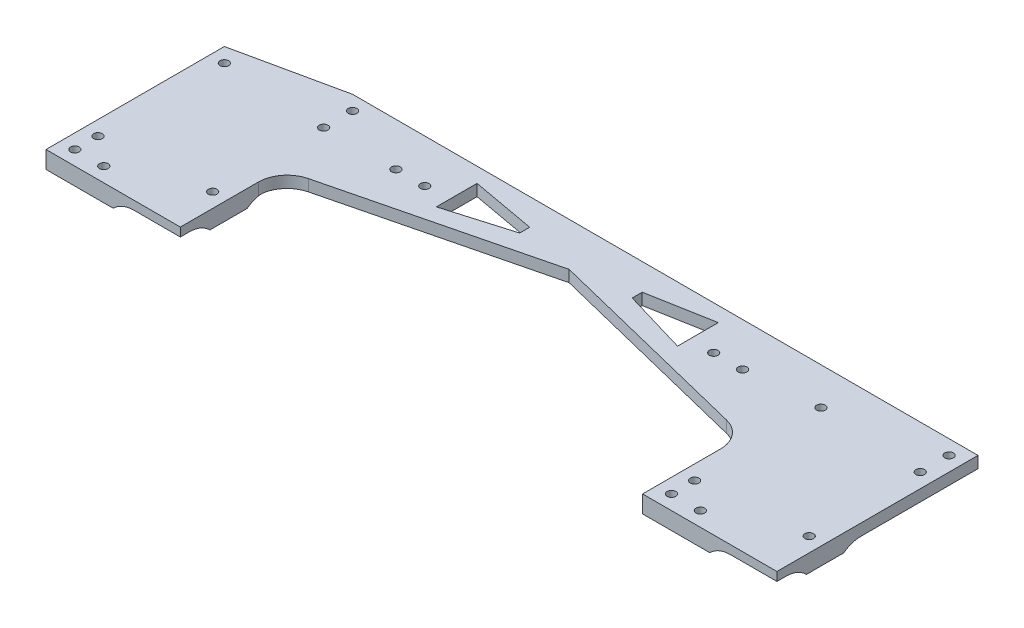
from build123d import *

# Parameters (mm, degrees)
SKETCH1_R           = 1.5
BOSS_EXTRUDE1_DEPTH = 3
SKETCH2_W           = 26.5
SKETCH2_H           = 13.12704922
BOSS_EXTRUDE2_DEPTH = 3
SKETCH3_R           = 1.5
CUT_EXTRUDE1_DEPTH  = 10
SKETCH4_R           = 1.5
CUT_EXTRUDE2_DEPTH  = 10
BOSS_EXTRUDE4_START = -4
SKETCH6_R           = 1.5
SKETCH6_W           = 26.5
SKETCH6_H           = 25.74798773
BOSS_EXTRUDE4_DEPTH = 4
SKETCH9_R           = 1.5
CUT_EXTRUDE3_DEPTH  = 6
CUT_EXTRUDE4_DEPTH  = 14
SKETCH11_R          = 1.5
CUT_EXTRUDE5_DEPTH  = 14
SKETCH12_W          = 9.439157555
SKETCH12_H          = 13.291874924
CUT_EXTRUDE6_DEPTH  = 10
BOSS_EXTRUDE5_START = -6
SKETCH14_R          = 1.5
SKETCH14_R_2        = 1.624180029
SKETCH14_W          = 10
SKETCH14_H          = 12.873993865
SKETCH14_R_3        = 1.585240738
BOSS_EXTRUDE5_DEPTH = 6
SKETCH15_W          = 23.25
SKETCH15_H          = 10.234024539
CUT_EXTRUDE7_DEPTH  = 3
FILLET2_R           = 10
FILLET4_R           = 10
SKETCH16_W          = 26.5
SKETCH16_H          = 25.74798773
SKETCH16_H_2        = 10.370938511
SKETCH16_W_2        = 9.439157555
SKETCH16_H_3        = 13.291874924
BOSS_EXTRUDE6_DEPTH = 4
FILLET5_R           = 10


with BuildPart() as part:
    # Sketch1 → Boss-Extrude1 (new body)
    with BuildSketch(Plane(origin=(0, 0, 0), x_dir=(1, 0, 0), z_dir=(0, 1, 0))):
        Polygon((-5, -5), (41.5, -5), (41.5, 64.6), (31.5, 64.6), (-5, 56.73), align=None)
        Polygon((31.5, 54.48), (31.5, 5.234024539), (5, 5.234024539), (5, 56.73), align=None, mode=Mode.SUBTRACT)
        with Locations(Location((0, 0, 0), (0, 0, 270))):
            Circle(SKETCH1_R, mode=Mode.SUBTRACT)
        with Locations(Location((0, 51.73, 0), (0, 0, 270))):
            Circle(SKETCH1_R, mode=Mode.SUBTRACT)
        with Locations(Location((36.5, 59.6, 0), (0, 0, 270))):
            Circle(SKETCH1_R, mode=Mode.SUBTRACT)
        with Locations(Location((36.5, 11.18, 0), (0, 0, 270))):
            Circle(SKETCH1_R, mode=Mode.SUBTRACT)
        with Locations(Location((36.5, 49.6, 0), (0, 0, 270))):
            Circle(SKETCH1_R, mode=Mode.SUBTRACT)
    extrude(amount=BOSS_EXTRUDE1_DEPTH)

    # Sketch2 → Boss-Extrude2 (add)
    with BuildSketch(Plane(origin=(0, 3, 0), x_dir=(1, 0, 0), z_dir=(0, 1, 0))):
        with Locations((18.25, 37.545536879)):
            Rectangle(SKETCH2_W, SKETCH2_H)
        Polygon((5, 56.73), (5, 49.867078553), (31.5, 54.48), align=None)
    extrude(amount=-BOSS_EXTRUDE2_DEPTH)

    # Sketch3 → Cut-Extrude1 (cut)
    with BuildSketch(Plane(origin=(0, 3, 0), x_dir=(1, 0, 0), z_dir=(0, 1, 0))):
        with Locations(Location((10, 0, 0), (0, 0, 270))):
            Circle(SKETCH3_R)
    extrude(amount=-CUT_EXTRUDE1_DEPTH, mode=Mode.SUBTRACT)

    # Sketch4 → Cut-Extrude2 (cut)
    with BuildSketch(Plane(origin=(0, 3, 0), x_dir=(1, 0, 0), z_dir=(0, 1, 0))):
        with Locations(Location((0, 8, 0), (0, 0, 270))):
            Circle(SKETCH4_R)
    extrude(amount=-CUT_EXTRUDE2_DEPTH, mode=Mode.SUBTRACT)

    # Sketch6 → Boss-Extrude4 (add)
    # profile 1 of 3: a face of its own
    with BuildSketch(Plane(origin=(0, 3, 0), x_dir=(1, 0, 0), z_dir=(0, 1, 0)).offset(BOSS_EXTRUDE4_START)):
        Polygon((238, 64.6), (41.5, 64.6), (41.5, 29.8), (121.5, 49.6), (201.5, 29.8), (201.5, 56.73), align=None)
    # profile 2 of 3: a face of its own
    with BuildSketch(Plane(origin=(0, 3, 0), x_dir=(1, 0, 0), z_dir=(0, 1, 0)).offset(BOSS_EXTRUDE4_START)):
        Polygon((31.5, 64.6), (-5, 56.73), (-5, -5), (41.5, -5), (41.5, 29.8), (41.5, 64.6), align=None)
        with Locations(Location((0, 0, 0), (0, 0, 270))):
            Circle(SKETCH6_R, mode=Mode.SUBTRACT)
        with Locations(Location((10, 0, 0), (0, 0, 270))):
            Circle(SKETCH6_R, mode=Mode.SUBTRACT)
        with Locations(Location((0, 8, 0), (0, 0, 270))):
            Circle(SKETCH6_R, mode=Mode.SUBTRACT)
        with Locations(Location((36.5, 11.18, 0), (0, 0, 270))):
            Circle(SKETCH6_R, mode=Mode.SUBTRACT)
        with Locations((18.25, 18.108018404)):
            Rectangle(SKETCH6_W, SKETCH6_H, mode=Mode.SUBTRACT)
        Polygon((31.5, 44.109061489), (5, 44.109061489), (5, 49.867078553), (31.5, 54.48), align=None, mode=Mode.SUBTRACT)
        with Locations(Location((0, 51.73, 0), (0, 0, 270))):
            Circle(SKETCH6_R, mode=Mode.SUBTRACT)
        with Locations(Location((36.5, 49.6, 0), (0, 0, 270))):
            Circle(SKETCH6_R, mode=Mode.SUBTRACT)
        with Locations(Location((36.5, 59.6, 0), (0, 0, 270))):
            Circle(SKETCH6_R, mode=Mode.SUBTRACT)
    # profile 3 of 3: a face of its own
    with BuildSketch(Plane(origin=(0, 3, 0), x_dir=(1, 0, 0), z_dir=(0, 1, 0)).offset(BOSS_EXTRUDE4_START)):
        Polygon((248, 64.6), (238, 64.6), (201.5, 56.73), (201.5, -5), (248, -5), align=None)
        with Locations(Location((206.5, 8, 0), (0, 0, 270))):
            Circle(SKETCH6_R, mode=Mode.SUBTRACT)
        with Locations(Location((206.5, 0, 0), (0, 0, 270))):
            Circle(SKETCH6_R, mode=Mode.SUBTRACT)
        with Locations(Location((216.5, 0, 0), (0, 0, 270))):
            Circle(SKETCH6_R, mode=Mode.SUBTRACT)
        with Locations(Location((243, 11.18, 0), (0, 0, 270))):
            Circle(SKETCH6_R, mode=Mode.SUBTRACT)
        with Locations(Location((243, 49.6, 0), (0, 0, 270))):
            Circle(SKETCH6_R, mode=Mode.SUBTRACT)
        with Locations(Location((243, 59.6, 0), (0, 0, 270))):
            Circle(SKETCH6_R, mode=Mode.SUBTRACT)
        with Locations(Location((206.5, 51.73, 0), (0, 0, 270))):
            Circle(SKETCH6_R, mode=Mode.SUBTRACT)
        with Locations((224.75, 18.108018404)):
            Rectangle(SKETCH6_W, SKETCH6_H, mode=Mode.SUBTRACT)
        Polygon((238, 54.48), (238, 44.109061489), (211.5, 44.109061489), (211.5, 49.867078553), align=None, mode=Mode.SUBTRACT)
    extrude(amount=BOSS_EXTRUDE4_DEPTH)

    # Sketch9 → Cut-Extrude3 (cut)
    with BuildSketch(Plane(origin=(0, 3, 0), x_dir=(1, 0, 0), z_dir=(0, 1, 0))):
        with Locations(Location((61.5, 49.6, 0), (0, 0, 270))):
            Circle(SKETCH9_R)
        with Locations(Location((181.5, 49.6, 0), (0, 0, 270))):
            Circle(SKETCH9_R)
    extrude(amount=-CUT_EXTRUDE3_DEPTH, mode=Mode.SUBTRACT)

    # Sketch10 → Cut-Extrude4 (cut)
    with BuildSketch(Plane(origin=(0, 3, 0), x_dir=(1, 0, 0), z_dir=(0, 1, 0))):
        Polygon((79.758586054, 59.447076053), (79.758586054, 45.354236602), (102.023308671, 51.934500024), (102.023308671, 55.399132807), align=None)
        Polygon((140.976691329, 51.934500024), (140.976691329, 55.399132807), (163.241413946, 59.447076053), (163.241413946, 45.354236602), align=None)
    extrude(amount=-CUT_EXTRUDE4_DEPTH, mode=Mode.SUBTRACT)

    # Sketch11 → Cut-Extrude5 (cut)
    with BuildSketch(Plane(origin=(0, 3, 0), x_dir=(1, 0, 0), z_dir=(0, 1, 0))):
        with Locations(Location((71.5, 49.6, 0), (0, 0, 270))):
            Circle(SKETCH11_R)
        with Locations(Location((171.5, 49.6, 0), (0, 0, 270))):
            Circle(SKETCH11_R)
    extrude(amount=-CUT_EXTRUDE5_DEPTH, mode=Mode.SUBTRACT)

    # Sketch12 → Cut-Extrude6 (cut)
    with BuildSketch(Plane(origin=(0, 3, 0), x_dir=(1, 0, 0), z_dir=(0, 1, 0))):
        with Locations((193.819806215, 48.516488721)):
            Rectangle(SKETCH12_W, SKETCH12_H)
        with Locations((49.180193786, 48.516488721)):
            Rectangle(SKETCH12_W, SKETCH12_H)
    extrude(amount=-CUT_EXTRUDE6_DEPTH, mode=Mode.SUBTRACT)

    # Sketch14 → Boss-Extrude5 (add)
    # profile 1 of 6: a face of its own
    with BuildSketch(Plane(origin=(0, 3, 0), x_dir=(1, 0, 0), z_dir=(0, 1, 0)).offset(BOSS_EXTRUDE5_START)):
        Polygon((5, 18.108018404), (-5, 18.108018404), (-5, -5), (5, -5), (18.25, -5), (18.25, 5.234024539), (5, 5.234024539), align=None)
        with Locations(Location((0, 0, 0), (0, 0, 270))):
            Circle(SKETCH14_R, mode=Mode.SUBTRACT)
        with Locations(Location((10, 0, 0), (0, 0, 270))):
            Circle(SKETCH14_R, mode=Mode.SUBTRACT)
        with Locations(Location((0, 8, 0), (0, 0, 270))):
            Circle(SKETCH14_R_2, mode=Mode.SUBTRACT)
    # profile 2 of 6: a face of its own
    with BuildSketch(Plane(origin=(0, 3, 0), x_dir=(1, 0, 0), z_dir=(0, 1, 0)).offset(BOSS_EXTRUDE5_START)):
        Polygon((31.5, 5.234024539), (18.25, 5.234024539), (18.25, -5), (31.5, -5), (41.5, -5), (41.5, 5.234024539), align=None)
    # profile 3 of 6: a face of its own
    with BuildSketch(Plane(origin=(0, 3, 0), x_dir=(1, 0, 0), z_dir=(0, 1, 0)).offset(BOSS_EXTRUDE5_START)):
        with Locations((36.5, 11.671021472)):
            Rectangle(SKETCH14_W, SKETCH14_H)
        with Locations(Location((36.5, 11.18, 0), (0, 0, 270))):
            Circle(SKETCH14_R_3, mode=Mode.SUBTRACT)
    # profile 4 of 6: a face of its own
    with BuildSketch(Plane(origin=(0, 3, 0), x_dir=(1, 0, 0), z_dir=(0, 1, 0)).offset(BOSS_EXTRUDE5_START)):
        with Locations((243, 11.671021472)):
            Rectangle(SKETCH14_W, SKETCH14_H)
        with Locations(Location((243, 11.18, 0), (0, 0, 270))):
            Circle(SKETCH14_R, mode=Mode.SUBTRACT)
    # profile 5 of 6: a face of its own
    with BuildSketch(Plane(origin=(0, 3, 0), x_dir=(1, 0, 0), z_dir=(0, 1, 0)).offset(BOSS_EXTRUDE5_START)):
        Polygon((248, -5), (248, 5.234024539), (238, 5.234024539), (224.75, 5.234024539), (224.75, -5), (238, -5), align=None)
    # profile 6 of 6: a face of its own
    with BuildSketch(Plane(origin=(0, 3, 0), x_dir=(1, 0, 0), z_dir=(0, 1, 0)).offset(BOSS_EXTRUDE5_START)):
        Polygon((224.75, -5), (224.75, 5.234024539), (211.5, 5.234024539), (211.5, 18.108018404), (201.5, 18.108018404), (201.5, -5), (211.5, -5), align=None)
        with Locations(Location((206.5, 0, 0), (0, 0, 270))):
            Circle(SKETCH14_R, mode=Mode.SUBTRACT)
        with Locations(Location((216.5, 0, 0), (0, 0, 270))):
            Circle(SKETCH14_R, mode=Mode.SUBTRACT)
        with Locations(Location((206.5, 8, 0), (0, 0, 270))):
            Circle(SKETCH14_R, mode=Mode.SUBTRACT)
    extrude(amount=BOSS_EXTRUDE5_DEPTH)

    # Sketch15 → Cut-Extrude7 (cut)
    with BuildSketch(Plane(origin=(0, -3, 0), x_dir=(-1, 0, 0), z_dir=(0, -1, 0))):
        with Locations((-29.875, 0.117012269)):
            Rectangle(SKETCH15_W, SKETCH15_H)
        with Locations((-236.375, 0.117012269)):
            Rectangle(SKETCH15_W, SKETCH15_H)
    extrude(amount=-CUT_EXTRUDE7_DEPTH, mode=Mode.SUBTRACT)

    # Fillet2
    # the kernel refuses this fillet: 10 mm, written as the material it adds along each edge
    with BuildSketch(Plane(origin=(224.75, 0, 5), x_dir=(1, 0, 0), z_dir=(0, 0, -1)), Plane(origin=(18.25, 0, 5), x_dir=(1, 0, 0), z_dir=(0, 0, -1))) as fillet2_piece_1:
        with BuildLine():
            CenterArc((7.141428429, 10), FILLET2_R, 224.427004001, 45.572995999)
            Line((0, 3), (0, 0))
            Line((0, 0), (7.141428429, 0))
        make_face()
    extrude(amount=10.234024539)
    with BuildSketch(Plane(origin=(238, 0, -5.234024539), x_dir=(0, -1, 0), z_dir=(1, 0, 0)), Plane(origin=(31.5, 0, -5.234024539), x_dir=(0, -1, 0), z_dir=(1, 0, 0))) as fillet2_piece_2:
        with BuildLine():
            CenterArc((10, -7.141428429), FILLET2_R, 134.427004001, 45.572995999)
            Line((0, -7.141428429), (0, 0))
            Line((0, 0), (3, 0))
        make_face()
    extrude(amount=10)

    # Fillet4
    # the kernel refuses this fillet: 10 mm, written as the material it adds along each edge
    with BuildSketch(Plane(origin=(238, -1, -18.108018404), x_dir=(0, -1, 0), z_dir=(1, 0, 0))) as fillet4_piece_1:
        with BuildLine():
            CenterArc((10, 6), FILLET4_R, 180, 36.869897646)
            Line((0, 6), (-0.2, 6))
            Line((-0.2, 6), (-0.2, 0))
            Line((-0.2, 0), (0, -0.2))
            ThreePointArc((0, -0.2), (1, -0.2), (1.84, -0.12))
            Line((1.84, -0.12), (2, 0))
        make_face()
    extrude(amount=10)
    with BuildSketch(Plane(origin=(201.5, -1, -18.108018404), x_dir=(0, 0, -1), z_dir=(1, 0, 0)), Plane(origin=(31.5, -1, -18.108018404), x_dir=(0, 0, -1), z_dir=(1, 0, 0)), Plane(origin=(-5, -1, -18.108018404), x_dir=(0, 0, -1), z_dir=(1, 0, 0))) as fillet4_piece_2:
        with BuildLine():
            CenterArc((6, -10), FILLET4_R, 90, 36.869897646)
            Line((0, -2), (-0.12, -1.84))
            ThreePointArc((-0.12, -1.84), (-0.2, -1), (-0.2, 0))
            Line((-0.2, 0), (0, 0.2))
            Line((0, 0.2), (6, 0.2))
            Line((6, 0.2), (6, 0))
        make_face()
    extrude(amount=10)

    # Sketch16 → Boss-Extrude6 (add)
    with BuildSketch(Plane(origin=(0, 3, 0), x_dir=(1, 0, 0), z_dir=(0, 1, 0))):
        with Locations((18.25, 18.108018404)):
            Rectangle(SKETCH16_W, SKETCH16_H)
        with Locations((224.75, 18.108018404)):
            Rectangle(SKETCH16_W, SKETCH16_H)
        with Locations((18.25, 49.294530745)):
            Rectangle(SKETCH16_W, SKETCH16_H_2)
        with Locations((224.75, 49.294530745)):
            Rectangle(SKETCH16_W, SKETCH16_H_2)
        with Locations((49.180193786, 48.516488721)):
            Rectangle(SKETCH16_W_2, SKETCH16_H_3)
        with Locations((193.819806215, 48.516488721)):
            Rectangle(SKETCH16_W_2, SKETCH16_H_3)
    extrude(amount=-BOSS_EXTRUDE6_DEPTH)

    # Fillet5
    fillet5_edges = [part.edges().sort_by_distance(p)[0] for p in [
        (41.5, 1, -29.8),
        (201.5, 1, -29.8),
    ]]
    fillet(fillet5_edges, radius=FILLET5_R)


solid = part.part
